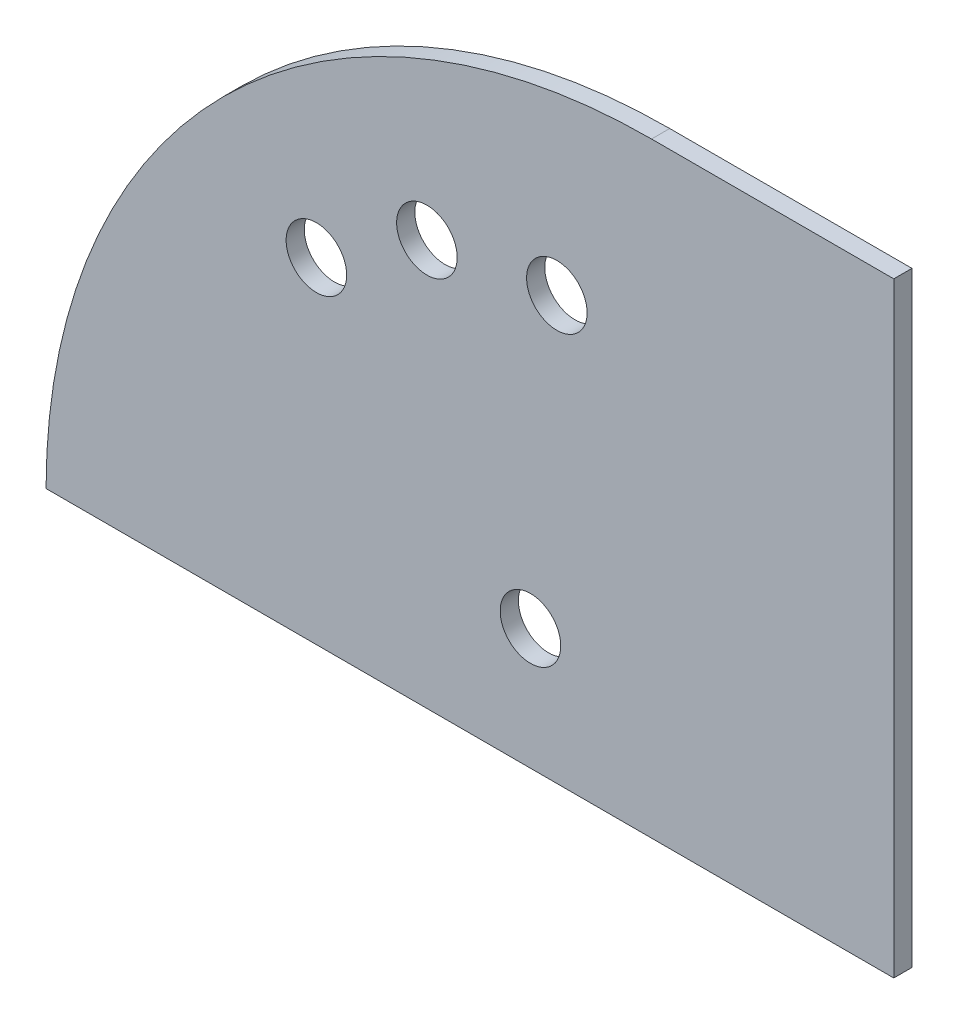
from build123d import *

# Parameters (mm, degrees)
ESBO_O1_R          = 5
FLANGE_BASE1_DEPTH = 3


# Sheet-metal steps are written as plain solids
with BuildPart() as part:
    # Esboço1 → Flange-base1 (new body)
    with BuildSketch(Plane.XY):
        with BuildLine():
            Line((0, 0), (-100, 0))
            ThreePointArc((-100, 0), (-70.710678119, 70.710678119), (0, 100))
            Line((0, 100), (40, 100))
            Line((40, 100), (40, 0))
            Line((40, 0), (0, 0))
        make_face()
        with Locations((-20, 20)):
            Circle(ESBO_O1_R, mode=Mode.SUBTRACT)
        with Locations((-55.355339059, 55.355339059)):
            Circle(ESBO_O1_R, mode=Mode.SUBTRACT)
        with Locations((-37.101007166, 66.984631039)):
            Circle(ESBO_O1_R, mode=Mode.SUBTRACT)
        with Locations((-15.642212863, 69.809734905)):
            Circle(ESBO_O1_R, mode=Mode.SUBTRACT)
    extrude(amount=-FLANGE_BASE1_DEPTH)


solid = part.part
